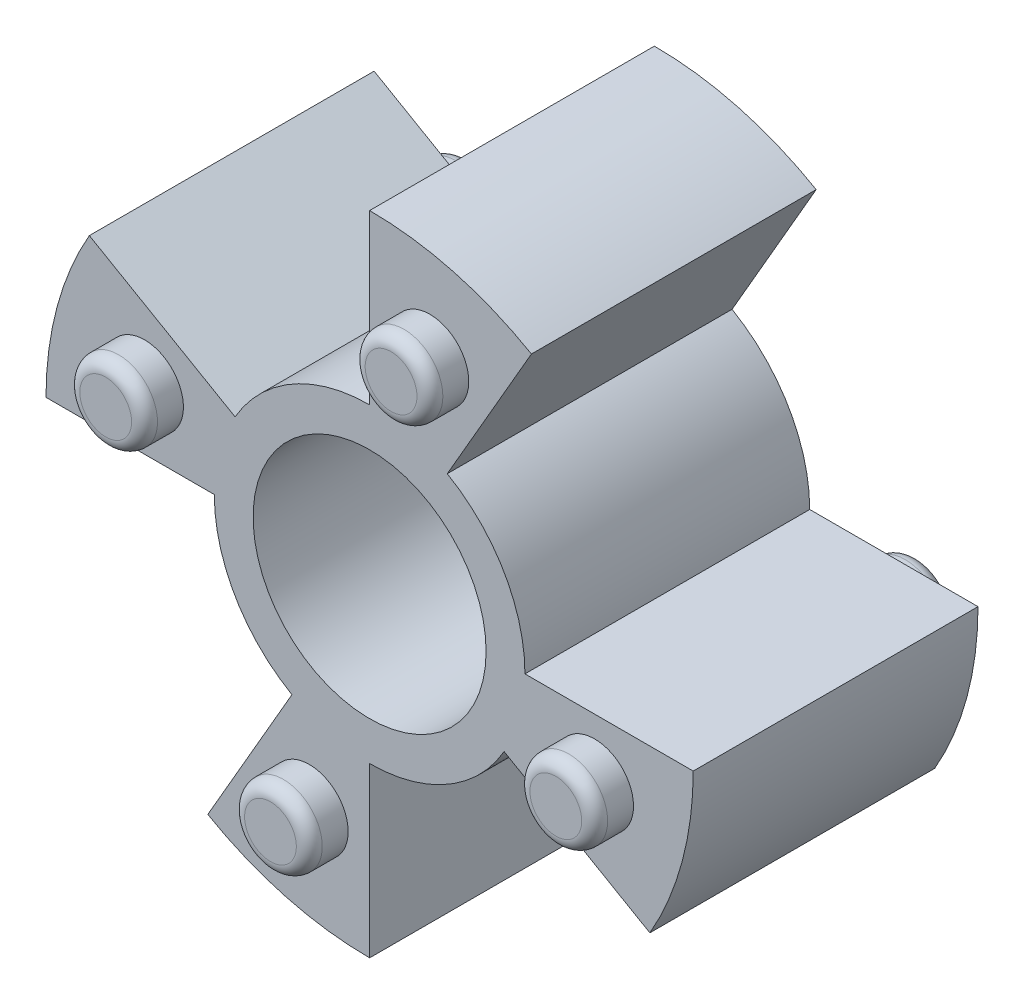
from build123d import *

# Parameters (mm, degrees)
ESBO_O1_R                    = 12.5
ESBO_O1_R_2                  = 4.5
RESSALTO_EXTRUS_O1_DEPTH     = 5.5
CORTE_EXTRUS_O2_DEPTH        = 21.820662814
PADR_OCIRCULAR1_COUNT        = 4
ESBO_O4_R                    = 1.5
RESSALTO_EXTRUS_O2_DEPTH     = 1.5
FILETE1_R                    = 0.5
FILETE1_OF_ESPELHAR1_R       = 0.5
PADR_OCIRCULAR2_COUNT        = 4
FILETE1_OF_PADR_OCIRCULAR2_R = 0.5


# Read off the part's stored shape, not the designer's step: PadrãoCircular3
with BuildPart() as part:
    # Esboço1 → Ressalto-extrusão1 (new, symmetric)
    with BuildSketch(Plane.XY):
        Circle(ESBO_O1_R)
        Circle(ESBO_O1_R_2, mode=Mode.SUBTRACT)
    extrude(amount=RESSALTO_EXTRUS_O1_DEPTH, both=True)

    # Esboço3 → Corte-extrusão2 (cut, through all)
    with BuildSketch(Plane.XY.offset(5.5)):
        with BuildLine():
            Line((-10.825317547, 6.25), (-5.196152423, 3))
            ThreePointArc((-5.196152423, 3), (-3, 5.196152423), (0, 6))
            Line((0, 6), (0, 12.5))
            ThreePointArc((0, 12.5), (-6.25, 10.825317547), (-10.825317547, 6.25))
        make_face()
    corte_extrus_o2 = extrude(amount=-CORTE_EXTRUS_O2_DEPTH, mode=Mode.SUBTRACT)

    # PadrãoCircular1: Corte-extrusão2 ×4 about axis
    padr_ocircular1_axis = Axis((0, 0, 5.5), (0, 0, -1))
    for i in range(1, PADR_OCIRCULAR1_COUNT):
        add(corte_extrus_o2.rotate(padr_ocircular1_axis, i * 360 / PADR_OCIRCULAR1_COUNT), mode=Mode.SUBTRACT)

    # Esboço4 → Ressalto-extrusão2 (add)
    with BuildSketch(Plane.XY.offset(5.5)):
        with Locations((8.693332437, -2.329371406)):
            Circle(ESBO_O4_R)
    ressalto_extrus_o2 = extrude(amount=RESSALTO_EXTRUS_O2_DEPTH)

    # Filete1
    filete1_edges = [part.edges().sort_by_distance(p)[0] for p in [
        (7.193332437, -2.329371406, 7),
    ]]
    fillet(filete1_edges, radius=FILETE1_R)

    # Espelhar1: Ressalto-extrusão2 across plane
    add(ressalto_extrus_o2.mirror(Plane.XY))

    # Filete1 of Espelhar1
    filete1_of_espelhar1_edges = [part.edges().sort_by_distance(p)[0] for p in [
        (7.193332437, -2.329371406, -7),
    ]]
    fillet(filete1_of_espelhar1_edges, radius=FILETE1_OF_ESPELHAR1_R)

    # PadrãoCircular2: Ressalto-extrusão2 ×4 about axis
    padr_ocircular2_axis = Axis((0, 0, 0), (0, 0, 1))
    for i in range(1, PADR_OCIRCULAR2_COUNT):
        add(ressalto_extrus_o2.rotate(padr_ocircular2_axis, i * 360 / PADR_OCIRCULAR2_COUNT))

    # Filete1 of PadrãoCircular2
    filete1_of_padr_ocircular2_edges = [part.edges().sort_by_distance(p)[0] for p in [
        (2.329371406, 7.193332437, 7),
        (-7.193332437, 2.329371406, 7),
        (-2.329371406, -7.193332437, 7),
    ]]
    fillet(filete1_of_padr_ocircular2_edges, radius=FILETE1_OF_PADR_OCIRCULAR2_R)

    # PadrãoCircular3 outline → PadrãoCircular3 (revolve)
    with BuildSketch(Plane(origin=(-8.693332437, 2.329371406, 0), x_dir=(1, 0, 0), z_dir=(0, -1, 0))):
        with BuildLine():
            Line((0, -5.5), (0, -7))
            Line((0, -7), (1, -7))
            ThreePointArc((1, -7), (1.353553391, -6.853553391), (1.5, -6.5))
            Line((1.5, -6.5), (1.5, -5.5))
            Line((1.5, -5.5), (0, -5.5))
        make_face()
    revolve(axis=Axis((-8.693332437, 2.329371406, 0), (0, 0, 1)))


solid = part.part
